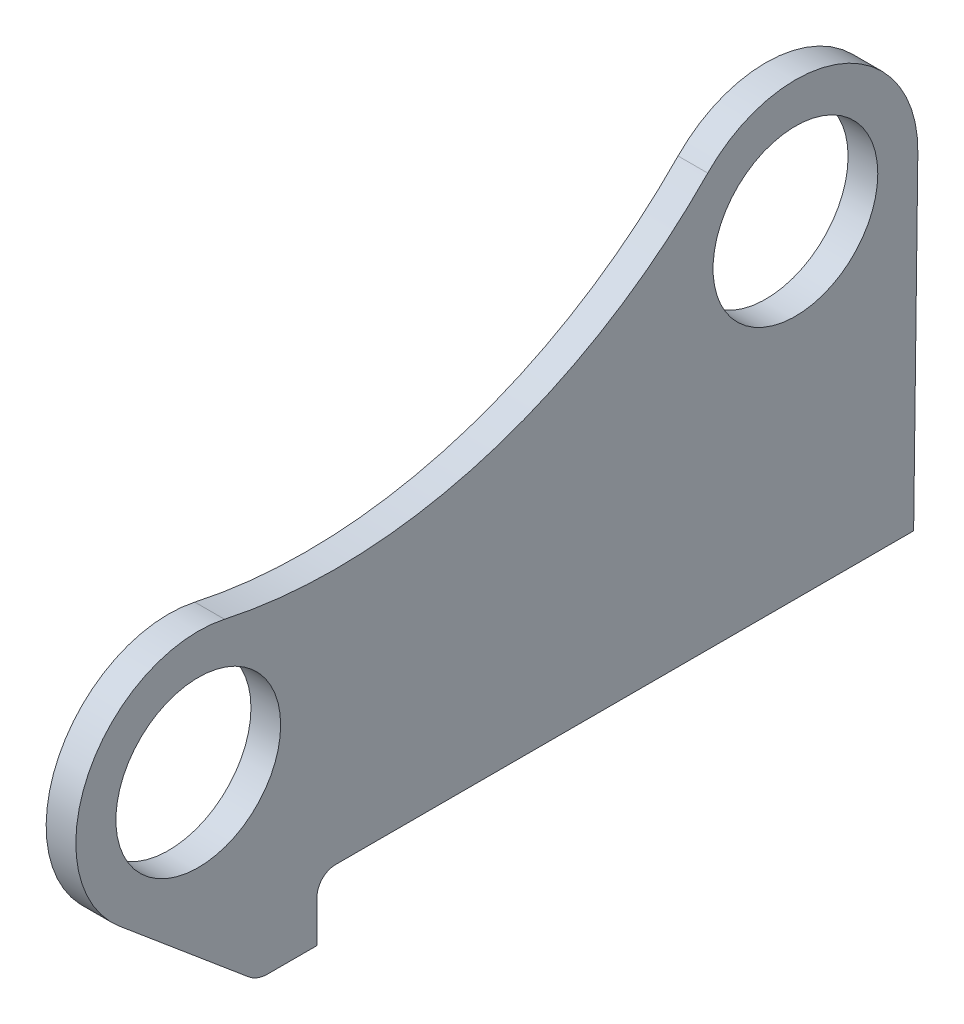
from build123d import *

# Parameters (mm, degrees)
SKETCH1_R          = 55.5
BASE_FLANGE1_DEPTH = 20


# Sheet-metal steps are written as plain solids
with BuildPart() as part:
    # Sketch1 → Base-Flange1 (new body)
    with BuildSketch(Plane(origin=(0, 0, 0), x_dir=(0, 0, -1), z_dir=(1, 0, 0))):
        with BuildLine():
            Line((0, -41), (0, -12.5))
            ThreePointArc((0, -12.5), (3.661165235, -3.661165235), (12.5, 0))
            Line((12.5, 0), (402, 0))
            Line((402, 0), (404.831276436, 219.451346471))
            ThreePointArc((404.831276436, 219.451346471), (353.919996754, 296.731364001), (263.269941068, 278.110759489))
            ThreePointArc((263.269941068, 278.110759489), (113.107275555, 187.171901633), (-62.321618696, 180.583651161))
            ThreePointArc((-62.321618696, 180.583651161), (-154.024103093, 136.42364838), (-133.058215758, 36.825038658))
            Line((-133.058215758, 36.825038658), (-45.972209781, -36.315142143))
            ThreePointArc((-45.972209781, -36.315142143), (-39.95421417, -39.792323471), (-33.109612021, -41))
            Line((-33.109612021, -41), (0, -41))
        make_face()
        with Locations((-80, 100)):
            Circle(SKETCH1_R, mode=Mode.SUBTRACT)
        with Locations((322.338141708, 220.515641005)):
            Circle(SKETCH1_R, mode=Mode.SUBTRACT)
    extrude(amount=-BASE_FLANGE1_DEPTH)


solid = part.part
